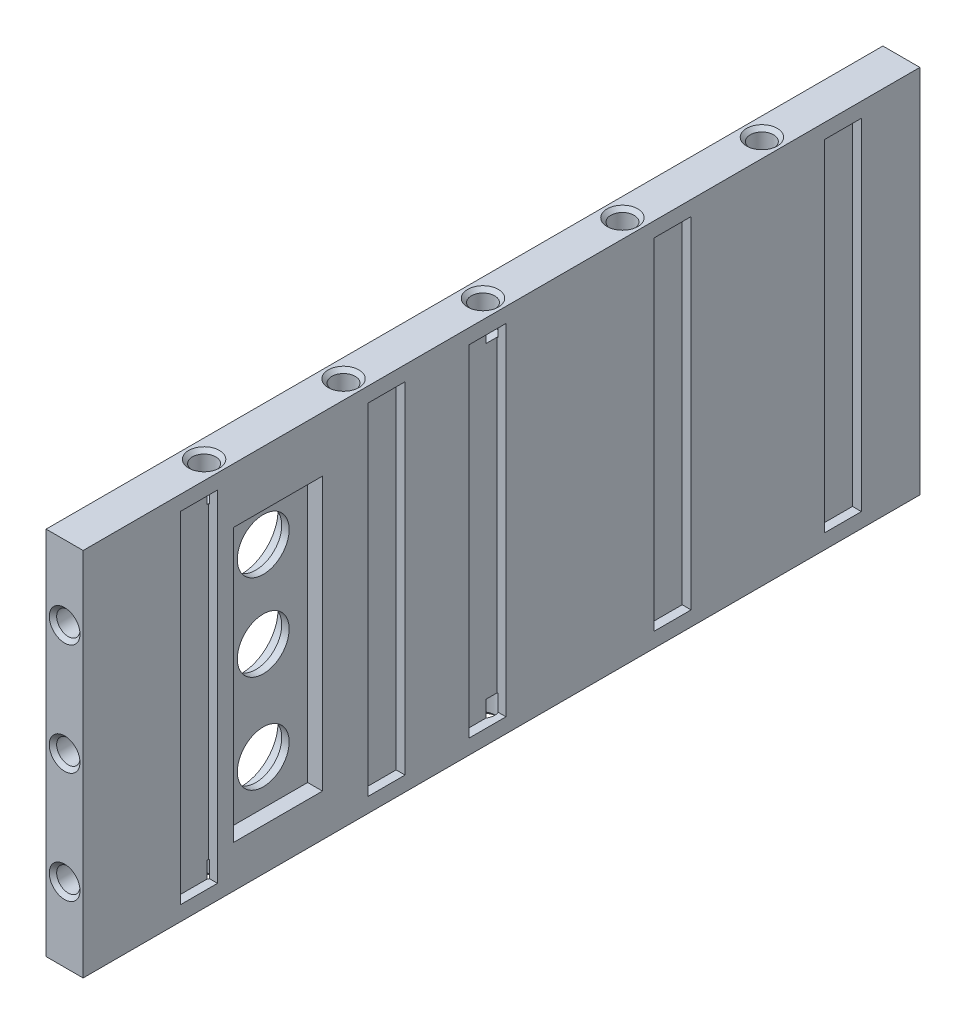
from build123d import *

# Parameters (mm, degrees)
SKETCH_1_W             = 113
SKETCH_1_H             = 50
EXTRUDE_1_DEPTH        = 5
SKETCH_2_R             = 1.575
CUT_EXTRUDE_610_DEPTH  = 4.2
SKETCH_3_R             = 1.575
CUT_EXTRUDE_919_DEPTH  = 4.2
SKETCH_4_W             = 5
SKETCH_4_H             = 46
CUT_EXTRUDE_1430_DEPTH = 1.2
SKETCH_5_R             = 3.5
SMA_DEPTH              = 116.840407458
SKETCH_6_R             = 5
SMA_2_DEPTH            = 2
SKETCH_7_W             = 12
SKETCH_7_H             = 36.84
SMA_3_DEPTH            = 2
CHAMFER_2761_SIZE      = 0.5


with BuildPart() as part:
    # Эскиз1 → Бобышка-Вытянуть1 (new body)
    with BuildSketch(Plane(origin=(0, 0, 0), x_dir=(0, 0, -1), z_dir=(1, 0, 0))):
        with Locations((-56.5, 0)):
            Rectangle(SKETCH_1_W, SKETCH_1_H)
    extrude(amount=EXTRUDE_1_DEPTH)

    # Эскиз2 → Cut-Extrude 610 (cut)
    with BuildSketch(Plane.XZ.offset(25)):
        with Locations((2.5, 94.166666667)):
            Circle(SKETCH_2_R)
        with Locations((2.5, 75.333333333)):
            Circle(SKETCH_2_R)
        with Locations((2.5, 56.5)):
            Circle(SKETCH_2_R)
        with Locations((2.5, 37.666666667)):
            Circle(SKETCH_2_R)
        with Locations((2.5, 18.833333333)):
            Circle(SKETCH_2_R)
    cut_extrude_610 = extrude(amount=-CUT_EXTRUDE_610_DEPTH, mode=Mode.SUBTRACT)

    # Зеркальное отражение1: Cut-Extrude 610 across plane
    add(cut_extrude_610.mirror(Plane(origin=(0, 0, 0), x_dir=(0, 0, 1), z_dir=(0, -1, 0))), mode=Mode.SUBTRACT)

    # Эскиз3 → Cut-Extrude 919 (cut)
    with BuildSketch(Plane.XY.offset(113)):
        with Locations((2.5, 15)):
            Circle(SKETCH_3_R)
        with Locations((2.5, 0)):
            Circle(SKETCH_3_R)
        with Locations((2.5, -15)):
            Circle(SKETCH_3_R)
    cut_extrude_919 = extrude(amount=-CUT_EXTRUDE_919_DEPTH, mode=Mode.SUBTRACT)

    # Зеркальное отражение2: Cut-Extrude 919 across plane
    add(cut_extrude_919.mirror(Plane(origin=(0, 0, 56.5), x_dir=(1, 0, 0), z_dir=(0, 0, -1))), mode=Mode.SUBTRACT)

    # Эскиз4 → Cut-Extrude 1430 (cut)
    with BuildSketch(Plane(origin=(5, 0, 0), x_dir=(0, 0, -1), z_dir=(1, 0, 0))):
        with Locations((-10.4, 0)):
            Rectangle(SKETCH_4_W, SKETCH_4_H)
        with Locations((-33.4, 0)):
            Rectangle(SKETCH_4_W, SKETCH_4_H)
        with Locations((-58.4, 0)):
            Rectangle(SKETCH_4_W, SKETCH_4_H)
        with Locations((-72.03, 0)):
            Rectangle(SKETCH_4_W, SKETCH_4_H)
        with Locations((-97.35, 0)):
            Rectangle(SKETCH_4_W, SKETCH_4_H)
    extrude(amount=-CUT_EXTRUDE_1430_DEPTH, mode=Mode.SUBTRACT)

    # Эскиз5 → SMA раземы (cut, through all)
    with BuildSketch(Plane(origin=(5, 0, 0), x_dir=(0, 0, -1), z_dir=(1, 0, 0))):
        with Locations((-86.68, 11.54)):
            Circle(SKETCH_5_R)
        with Locations((-86.68, -0.09)):
            Circle(SKETCH_5_R)
        with Locations((-86.68, -13.3)):
            Circle(SKETCH_5_R)
    extrude(amount=-SMA_DEPTH, mode=Mode.SUBTRACT)

    # Эскиз6 → SMA раземы2 (cut)
    with BuildSketch(Plane.ZY):
        with Locations((86.68, 11.54)):
            Circle(SKETCH_6_R)
        with Locations((86.68, -0.09)):
            Circle(SKETCH_6_R)
        with Locations((86.68, -13.3)):
            Circle(SKETCH_6_R)
    extrude(amount=-SMA_2_DEPTH, mode=Mode.SUBTRACT)

    # Эскиз7 → SMA раземы3 (cut)
    with BuildSketch(Plane(origin=(5, 0, 0), x_dir=(0, 0, -1), z_dir=(1, 0, 0))):
        with Locations((-86.68, -0.88)):
            Rectangle(SKETCH_7_W, SKETCH_7_H)
    extrude(amount=-SMA_3_DEPTH, mode=Mode.SUBTRACT)

    # Chamfer 2761
    chamfer_2761_edges = [part.edges().sort_by_distance(p)[0] for p in [
        (0.925, 15, 0),
        (0.925, 0, 0),
        (0.925, -15, 0),
        (0.925, -25, 18.833333333),
        (0.925, -25, 37.666666667),
        (0.925, -25, 56.5),
        (0.925, -25, 75.333333333),
        (0.925, -25, 94.166666667),
        (0.925, -15, 113),
        (0.925, 0, 113),
        (0.925, 15, 113),
        (0.925, 25, 94.166666667),
        (0.925, 25, 75.333333333),
        (0.925, 25, 56.5),
        (0.925, 25, 37.666666667),
        (0.925, 25, 18.833333333),
    ]]
    chamfer(chamfer_2761_edges, length=CHAMFER_2761_SIZE)


solid = part.part
